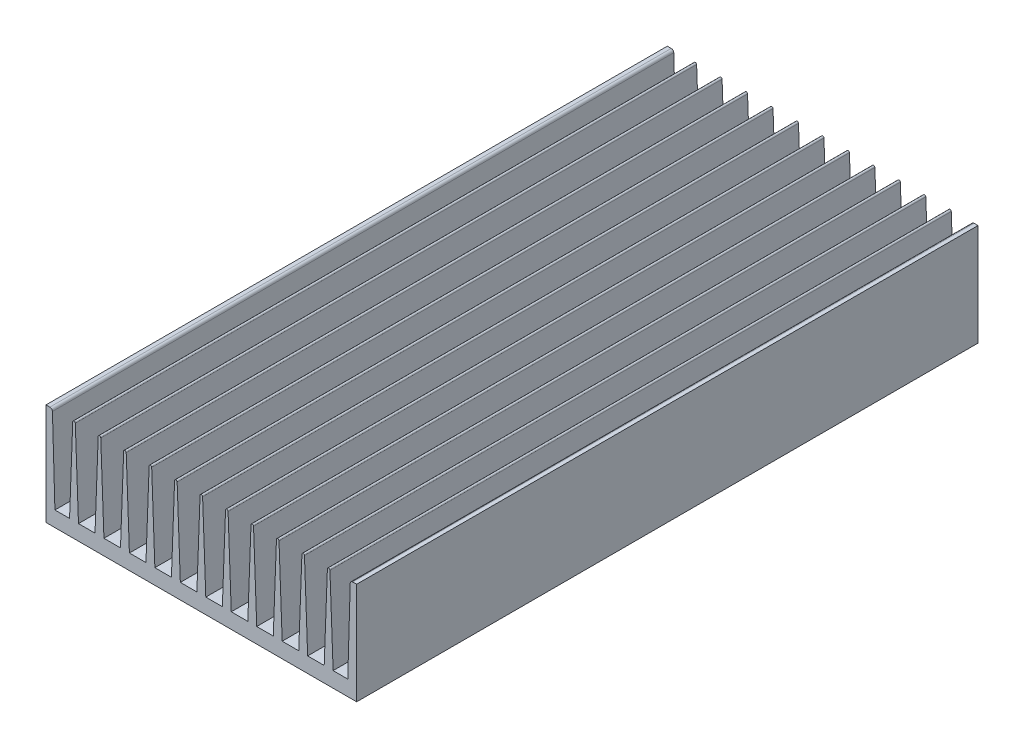
from build123d import *

# Parameters (mm, degrees)
EXTRUDE_1_DEPTH       = 244
EXTRUDE_3_DEPTH       = 244
PATTERN_CURVE_1_COUNT = 11
PATTERN_CURVE_1_PITCH = 10
SKETCH_3_R            = 2.25
CUT_EXTRUDE_1_DEPTH   = 6
SKETCH_4_R            = 1.6
SKETCH_4_R_2          = 1.3
CUT_EXTRUDE_2_DEPTH   = 6


with BuildPart() as part:
    # Эскиз1 → Вытянуть1 (new body)
    with BuildSketch(Plane.XY):
        with BuildLine():
            Line((0, 40), (1.528979332, 40))
            ThreePointArc((1.528979332, 40), (2.225614441, 39.717425624), (2.528547087, 39.029399052))
            Line((2.528547087, 39.029399052), (3.5, 6))
            Line((3.5, 6), (118.5, 6))
            Line((118.5, 6), (119.471452913, 39.029399052))
            ThreePointArc((119.471452913, 39.029399052), (119.774385559, 39.717425624), (120.471020668, 40))
            Line((120.471020668, 40), (122, 40))
            Line((122, 40), (122, 0))
            Line((122, 0), (0, 0))
            Line((0, 0), (0, 40))
        make_face()
    extrude(amount=EXTRUDE_1_DEPTH)

    # Эскиз2 → Вытянуть3 (add)
    with BuildSketch(Plane.XY.offset(244)):
        with BuildLine():
            Line((10.5, 39.5), (9.25, 6))
            Line((9.25, 6), (12.75, 6))
            Line((12.75, 6), (11.5, 39.5))
            ThreePointArc((11.5, 39.5), (11, 40), (10.5, 39.5))
        make_face()
    extrude_3 = extrude(amount=-EXTRUDE_3_DEPTH)

    # Кривая1: Вытянуть3 ×11
    with Locations(*[(i * PATTERN_CURVE_1_PITCH, 0, 0) for i in range(1, PATTERN_CURVE_1_COUNT)]):
        add(extrude_3)

    # Эскиз3 → Вырез-Вытянуть1 (cut)
    with BuildSketch(Plane.XZ):
        with Locations((26, 236)):
            Circle(SKETCH_3_R)
        with Locations((96, 236)):
            Circle(SKETCH_3_R)
        with Locations((96, 8)):
            Circle(SKETCH_3_R)
        with Locations((26, 8)):
            Circle(SKETCH_3_R)
    extrude(amount=-CUT_EXTRUDE_1_DEPTH, mode=Mode.SUBTRACT)

    # Эскиз4 → Вырез-Вытянуть2 (cut)
    with BuildSketch(Plane(origin=(133.240090243, 0, 310.149074448), x_dir=(-1, 0, 0), z_dir=(0, -1, 0))):
        with Locations((71.240090243, 92.149074448)):
            Circle(SKETCH_4_R)
        with Locations((71.240090243, 227.149074448)):
            Circle(SKETCH_4_R)
        with Locations((31.490090243, 223.549074448)):
            Circle(SKETCH_4_R)
        with Locations((31.490090243, 139.749074448)):
            Circle(SKETCH_4_R)
        with Locations((34.240090243, 100.649074448)):
            Circle(SKETCH_4_R_2)
        with Locations((91.240090243, 285.149074448)):
            Circle(SKETCH_4_R)
        with Locations((91.240090243, 237.149074448)):
            Circle(SKETCH_4_R)
        with Locations((25.240090243, 237.149074448)):
            Circle(SKETCH_4_R)
        with Locations((25.240090243, 285.149074448)):
            Circle(SKETCH_4_R)
    extrude(amount=-CUT_EXTRUDE_2_DEPTH, mode=Mode.SUBTRACT)


solid = part.part
